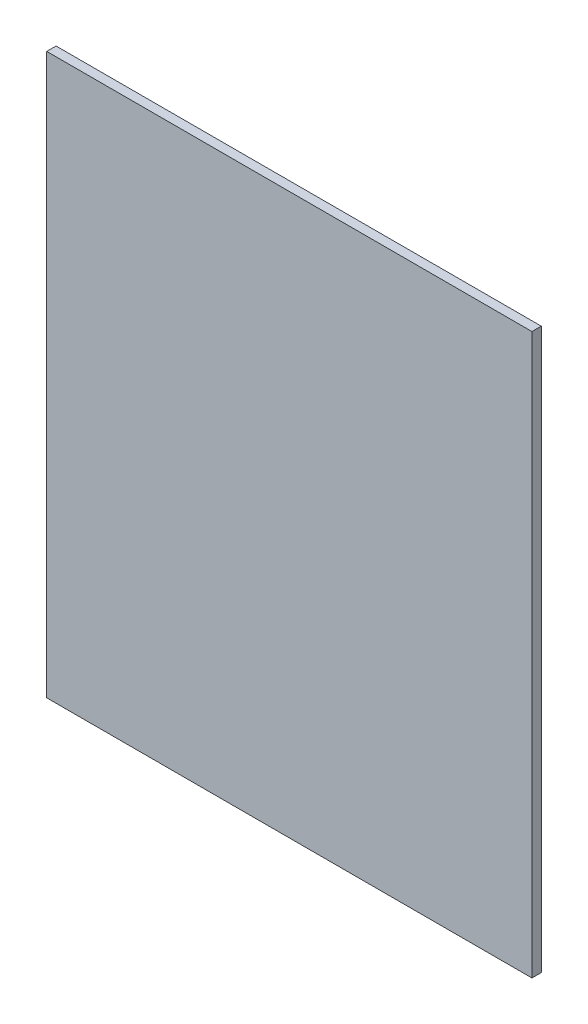
from build123d import *

# Parameters (mm, degrees)
SKETCH1_W           = 330.2
SKETCH1_H           = 381
BOSS_EXTRUDE1_DEPTH = 3.175


with BuildPart() as part:
    # Sketch1 → Boss-Extrude1 (new, symmetric)
    with BuildSketch(Plane.XY):
        Rectangle(SKETCH1_W, SKETCH1_H)
    extrude(amount=BOSS_EXTRUDE1_DEPTH, both=True)


solid = part.part
